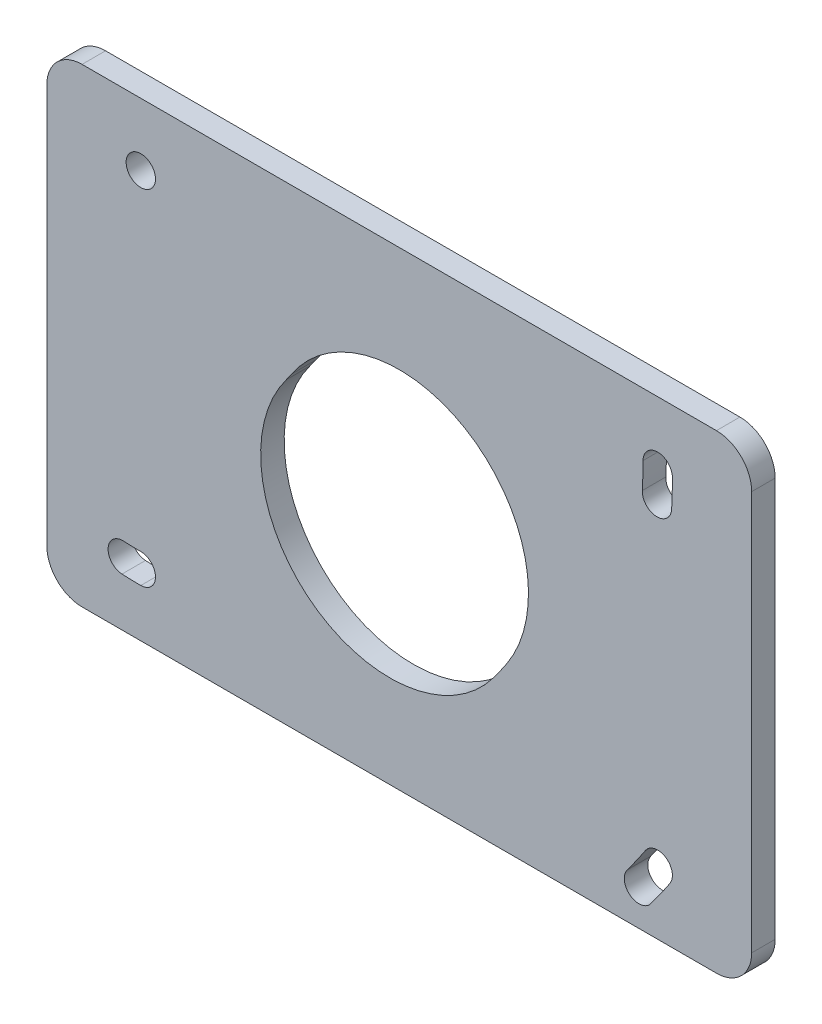
from build123d import *

# Parameters (mm, degrees)
SZKIC1_R                    = 1.25
DODANIE_WYCI_GNI_CIE1_DEPTH = 2


with BuildPart() as part:
    # Szkic1 → Dodanie-wyciągnięcie1 (new body)
    with BuildSketch(Plane.XY):
        with BuildLine():
            ThreePointArc((-30, -17), (-29.121320344, -19.121320344), (-27, -20))
            Line((-27, -20), (27, -20))
            ThreePointArc((27, -20), (29.121320344, -19.121320344), (30, -17))
            Line((30, -17), (30, 17))
            ThreePointArc((30, 17), (29.121320344, 19.121320344), (27, 20))
            Line((27, 20), (-27, 20))
            ThreePointArc((-27, 20), (-29.121320344, 19.121320344), (-30, 17))
            Line((-30, 17), (-30, -17))
        make_face()
        with BuildLine():
            ThreePointArc((-22, -15.916666667), (-22.800578336, -15.906186522), (-23.600607995, -15.874753271))
            ThreePointArc((-23.600607995, -15.874753271), (-24.783474968, -14.561046407), (-23.469768104, -13.378179434))
            ThreePointArc((-23.469768104, -13.378179434), (-22.735135965, -13.40704321), (-22, -13.416666667))
            ThreePointArc((-22, -13.416666667), (-20.75, -14.666666667), (-22, -15.916666667))
        make_face(mode=Mode.SUBTRACT)
        with BuildLine():
            ThreePointArc((9.152553238, -6.101702158), (8.598225519, -6.910064133), (8.022927304, -7.703638494))
            ThreePointArc((8.022927304, -7.703638494), (-7.370091874, -9.951962445), (-9.618415825, 5.441056733))
            ThreePointArc((-9.618415825, 5.441056733), (-9.38116037, 5.768330208), (-9.152553238, 6.101702158))
            ThreePointArc((-9.152553238, 6.101702158), (6.101702158, 9.152553238), (9.152553238, -6.101702158))
        make_face(mode=Mode.SUBTRACT)
        with BuildLine():
            ThreePointArc((23.040062868, -15.360041912), (22.238621165, -16.528763906), (21.406860521, -17.676106111))
            ThreePointArc((21.406860521, -17.676106111), (19.657653796, -17.931597469), (19.402162438, -16.182390744))
            ThreePointArc((19.402162438, -16.182390744), (20.195509132, -15.088037277), (20.959937132, -13.973291421))
            ThreePointArc((20.959937132, -13.973291421), (22.693375245, -13.626603799), (23.040062868, -15.360041912))
        make_face(mode=Mode.SUBTRACT)
        with Locations((-22, 14.666666667)):
            Circle(SZKIC1_R, mode=Mode.SUBTRACT)
        with BuildLine():
            ThreePointArc((20.691412611, 12.429304537), (20.735350643, 13.547602127), (20.75, 14.666666667))
            ThreePointArc((20.75, 14.666666667), (22, 15.916666667), (23.25, 14.666666667))
            ThreePointArc((23.25, 14.666666667), (23.234493955, 13.482159756), (23.187986448, 12.298464647))
            ThreePointArc((23.187986448, 12.298464647), (21.874279584, 11.115597674), (20.691412611, 12.429304537))
        make_face(mode=Mode.SUBTRACT)
    extrude(amount=DODANIE_WYCI_GNI_CIE1_DEPTH)


solid = part.part
